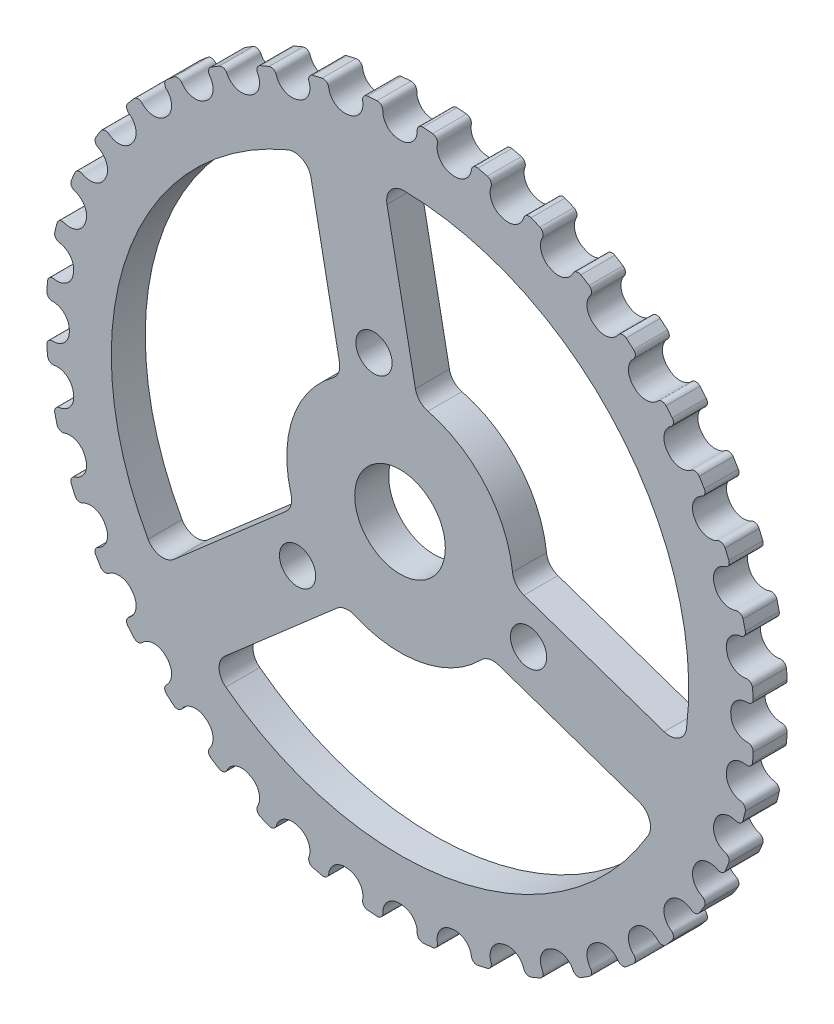
from build123d import *

# Parameters (mm, degrees)
SKETCHREVOLVEGEARBELT01_W       = 3
SKETCHREVOLVEGEARBELT01_H       = 31.259474731
TOOTHEXTRUDECUTGEARBELT01_DEPTH = 7.238999891
PATTERNGEARBELT01_COUNT         = 40
BOREREVOLVESKETCH_W             = 14.477999782
BOREREVOLVESKETCH_H             = 4
SKETCH1_R                       = 1.6
CUT_EXTRUDE1_DEPTH              = 10


with BuildPart() as part:
    # SketchRevolveGearBelt01 → GearBelt01 (revolve)
    with BuildSketch(Plane(origin=(0, 0, 0), x_dir=(0, 0, -1), z_dir=(1, 0, 0))):
        with Locations((0, 15.629737366)):
            Rectangle(SKETCHREVOLVEGEARBELT01_W, SKETCHREVOLVEGEARBELT01_H)
    revolve(axis=Axis((0, 0, 0), (0, 0, -1)))

    # SketchToothGearBelt01 → ToothExtrudeCutGearBelt01 (cut, symmetric)
    with BuildSketch(Plane.XY):
        with BuildLine():
            ThreePointArc((31.193039128, 2.038865882), (31.259601152, 0), (31.193039128, -2.038865882))
            add(Edge.make_bspline(
                [(31.193039128, -2.038865882), (31.194776913, -2.012319058), (31.194111995, -1.972286092), (31.186725044, -1.91954954), (31.177972892, -1.880581805), (31.166066964, -1.842459179), (31.151086916, -1.805436436), (31.133132836, -1.769761004), (31.11232472, -1.735671302), (31.088801629, -1.703395156), (31.062720769, -1.673148271), (31.03425644, -1.645132783), (31.003598871, -1.619535939), (30.970952951, -1.596528744), (30.936536852, -1.576265181), (30.900580587, -1.558879838), (30.863324423, -1.544492019), (30.825017467, -1.533186249), (30.785915276, -1.525081482), (30.746280852, -1.520069931), (30.699160655, -1.5185581), (30.627744929, -1.519642809), (30.531954075, -1.516025397), (30.419766309, -1.502618406), (30.308964203, -1.4805345), (30.200238466, -1.449806972), (30.094256736, -1.410652655), (29.991672503, -1.363305381), (29.893117585, -1.308058815), (29.799199177, -1.245252775), (29.710495857, -1.175274324), (29.627554091, -1.09855453), (29.55088484, -1.015566038), (29.480960449, -0.926820101), (29.418211615, -0.832863447), (29.363025195, -0.73427489), (29.31574008, -0.631661826), (29.276651638, -0.525656278), (29.245985501, -0.416911781), (29.223987221, -0.306096466), (29.210580967, -0.193899714), (29.207480791, -0.105119728), (29.207768884, -0.040500395), (29.2077087, 0), (29.207768884, 0.040500395), (29.207480791, 0.105119728), (29.210580967, 0.193899714), (29.223987221, 0.306096466), (29.245985501, 0.416911781), (29.276651638, 0.525656278), (29.31574008, 0.631661826), (29.363025195, 0.73427489), (29.418211615, 0.832863447), (29.480960449, 0.926820101), (29.55088484, 1.015566038), (29.627554091, 1.09855453), (29.710495857, 1.175274324), (29.799199177, 1.245252775), (29.893117585, 1.308058815), (29.991672503, 1.363305381), (30.094256736, 1.410652655), (30.200238466, 1.449806972), (30.308964203, 1.4805345), (30.419766309, 1.502618406), (30.531954075, 1.516025397), (30.627744929, 1.519642809), (30.699160655, 1.5185581), (30.746280852, 1.520069931), (30.785915276, 1.525081482), (30.825017467, 1.533186249), (30.863324423, 1.544492019), (30.900580587, 1.558879838), (30.936536852, 1.576265181), (30.970952951, 1.596528744), (31.003598871, 1.619535939), (31.03425644, 1.645132783), (31.062720769, 1.673148271), (31.088801629, 1.703395156), (31.11232472, 1.735671302), (31.133132836, 1.769761004), (31.151086916, 1.805436436), (31.166066964, 1.842459179), (31.177972892, 1.880581805), (31.186725044, 1.91954954), (31.194111995, 1.972286092), (31.194776913, 2.012319058), (31.193039128, 2.038865882)],
                knots=[0, 0, 0, 0, 0.012475647, 0.018713471, 0.024951294, 0.031189118, 0.037426941, 0.043664765, 0.049902589, 0.056140412, 0.062378236, 0.068616059, 0.074853883, 0.081091706, 0.08732953, 0.093567353, 0.099805177, 0.106043001, 0.112280824, 0.118518648, 0.124756471, 0.134376181, 0.152024115, 0.169672048, 0.187319982, 0.204967916, 0.22261585, 0.240263783, 0.257911717, 0.275559651, 0.293207585, 0.310855518, 0.328503452, 0.346151386, 0.36379932, 0.381447253, 0.399095187, 0.416743121, 0.434391055, 0.452038988, 0.469686922, 0.487334856, 0.493667428, 0.5, 0.506332572, 0.512665144, 0.530313078, 0.547961012, 0.565608945, 0.583256879, 0.600904813, 0.618552747, 0.63620068, 0.653848614, 0.671496548, 0.689144482, 0.706792415, 0.724440349, 0.742088283, 0.759736217, 0.77738415, 0.795032084, 0.812680018, 0.830327952, 0.847975885, 0.865623819, 0.875243529, 0.881481352, 0.887719176, 0.893956999, 0.900194823, 0.906432647, 0.91267047, 0.918908294, 0.925146117, 0.931383941, 0.937621764, 0.943859588, 0.950097411, 0.956335235, 0.962573059, 0.968810882, 0.975048706, 0.981286529, 0.987524353, 1, 1, 1, 1], degree=3))
        make_face()
    toothextrudecutgearbelt01 = extrude(amount=TOOTHEXTRUDECUTGEARBELT01_DEPTH, both=True, mode=Mode.SUBTRACT)

    # PatternGearBelt01: ToothExtrudeCutGearBelt01 ×40 about axis
    patterngearbelt01_axis = Axis((0, 0, 55), (0, 0, -1))
    for i in range(1, PATTERNGEARBELT01_COUNT):
        add(toothextrudecutgearbelt01.rotate(patterngearbelt01_axis, i * 360 / PATTERNGEARBELT01_COUNT), mode=Mode.SUBTRACT)

    # BoreRevolveSketch → BoreRevolveCut (revolve, cut)
    with BuildSketch(Plane(origin=(0, 0, 0), x_dir=(0, 0, -1), z_dir=(1, 0, 0))):
        with Locations((0, 2)):
            Rectangle(BOREREVOLVESKETCH_W, BOREREVOLVESKETCH_H)
    revolve(axis=Axis((0, 0, 0), (0, 0, -1)), mode=Mode.SUBTRACT)

    # Sketch1 → Cut-Extrude1 (cut)
    with BuildSketch(Plane(origin=(0, 0, -1.5), x_dir=(-1, 0, 0), z_dir=(0, 0, -1))):
        with Locations((9.048272131, -7.882180627)):
            Circle(SKETCH1_R)
        with Locations((2.302032595, 11.77712384)):
            Circle(SKETCH1_R)
        with Locations((-11.350304726, -3.894943212)):
            Circle(SKETCH1_R)
        with BuildLine():
            Line((5.5909894, -9.40639321), (15.465623766, -18.008439056))
            ThreePointArc((15.465623766, -18.008439056), (15.979460173, -19.191166867), (15.385373137, -20.335690139))
            ThreePointArc((15.385373137, -20.335690139), (-4.891819264, -25.026388159), (-21.910302624, -13.045636776))
            ThreePointArc((-21.910302624, -13.045636776), (-22.02969775, -11.761651678), (-21.108329195, -10.859458287))
            Line((-21.108329195, -10.859458287), (-8.721421785, -6.608796996))
            ThreePointArc((-8.721421785, -6.608796996), (-7.88707058, -6.568388269), (-7.160481638, -6.980508771))
            ThreePointArc((-7.160481638, -6.980508771), (-1.918360496, -9.814269866), (4.004971149, -9.162980197))
            ThreePointArc((4.004971149, -9.162980197), (4.83326398, -9.054786916), (5.5909894, -9.40639321))
        make_face()
        with BuildLine():
            Line((10.08409698, -4.248574325), (19.958731346, -12.850620171))
            ThreePointArc((19.958731346, -12.850620171), (21.200738019, -13.19745205), (22.253004169, -12.452060289))
            ThreePointArc((22.253004169, -12.452060289), (24.119397543, 8.276754326), (9.918537696, 23.491969053))
            ThreePointArc((9.918537696, 23.491969053), (8.630307948, 23.434201882), (7.862953822, 22.397842595))
            Line((7.862953822, 22.397842595), (5.350680778, 9.545135458))
            ThreePointArc((5.350680778, 9.545135458), (5.425043505, 8.713122848), (5.93288805, 8.049896856))
            ThreePointArc((5.93288805, 8.049896856), (9.458587272, 3.24578601), (9.625538747, -2.710904616))
            ThreePointArc((9.625538747, -2.710904616), (9.631926393, -3.546209349), (10.08409698, -4.248574325))
        make_face()
        with BuildLine():
            Line((-10.941670178, -0.138742248), (-23.328577588, -4.389403538))
            ThreePointArc((-23.328577588, -4.389403538), (-24.609768122, -4.243035015), (-25.303910833, -3.156278913))
            ThreePointArc((-25.303910833, -3.156278913), (-19.227578279, 16.749633833), (-0.342701545, 25.497697066))
            ThreePointArc((-0.342701545, 25.497697066), (0.828959731, 24.959103728), (1.149597849, 23.710078458))
            Line((1.149597849, 23.710078458), (-1.362675195, 10.857371322))
            ThreePointArc((-1.362675195, 10.857371322), (-1.744855813, 10.114597619), (-2.465057108, 9.691413388))
            ThreePointArc((-2.465057108, 9.691413388), (-7.540226776, 6.568483856), (-9.9378592, 1.113083342))
            ThreePointArc((-9.9378592, 1.113083342), (-10.258307485, 0.341664068), (-10.941670178, -0.138742248))
        make_face()
    extrude(amount=-CUT_EXTRUDE1_DEPTH, mode=Mode.SUBTRACT)


solid = part.part
